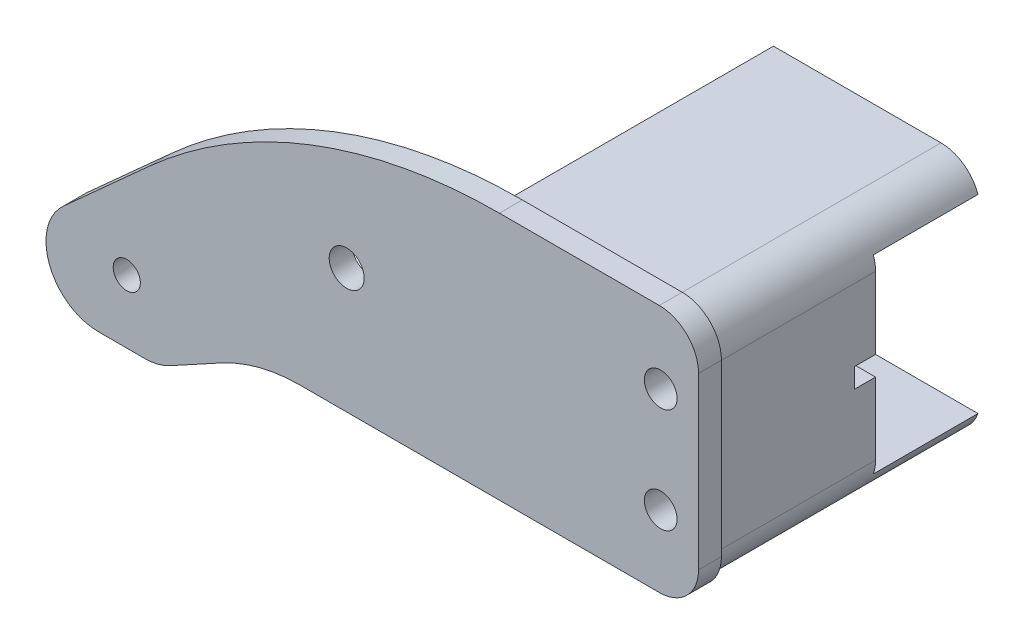
from build123d import *

# Parameters (mm, degrees)
SKETCH1_R                 = 2.075
SKETCH1_R_2               = 2.675
BOSS_EXTRUDE1_DEPTH       = 3.5
SKETCH2_4_W               = 8.840351234
SKETCH2_4_H               = 4
SKETCH2_4_H_2             = 13
SKETCH2_4_R               = 2.5
SKETCH2_4_W_2             = 33.159648766
BOSS_EXTRUDE3_DEPTH       = 24
SKETCH2_7_W               = 8.840351234
SKETCH2_7_H               = 3
BOSS_EXTRUDE5_DEPTH       = 20.8
SKETCH2_9_R               = 2.5
CUT_EXTRUDE3_DEPTH        = 81.663628326
BOSS_EXTRUDE6_START       = 24
BOSS_EXTRUDE6_OUTLINE_W   = 42
BOSS_EXTRUDE6_OUTLINE_H   = 4
BOSS_EXTRUDE6_OUTLINE_W_2 = 58.427054107
BOSS_EXTRUDE6_DEPTH       = 16
BOSS_EXTRUDE7_DEPTH       = 15.25
MEDZERA_SIZE              = 10.390521491
MEDZERA_SIZE_2            = 16
FILLET1_R                 = 8
BOSS_EXTRUDE8_START       = 7
SKETCH3_R                 = 5.280073369
SKETCH3_R_2               = 2.075
BOSS_EXTRUDE8_DEPTH       = 7
FILLET2_R                 = 11
FILLET3_R                 = 6
CHAMFER2_SIZE             = 2
FILLET4_R                 = 80
FILLET5_R                 = 25


# Read off the part's stored shape, not the designer's step: Boss-Extrude6
with BuildPart() as part:
    # Sketch1 → Boss-Extrude1 (new body)
    with BuildSketch(Plane.XY):
        Polygon((-56.932747655, 5.511620917), (-26.973961957, 5.511620917), (-11.681296445, 13.858299038), (55.612607206, 13.858299038), (55.612607206, 51.858299038), (-5.576823635, 51.858299038), align=None)
        with Locations((-31.780792342, 15.1829237)):
            Circle(SKETCH1_R, mode=Mode.SUBTRACT)
        with Locations((1.831518612, 32.908965344)):
            Circle(SKETCH1_R_2, mode=Mode.SUBTRACT)
    extrude(amount=BOSS_EXTRUDE1_DEPTH)

    # Sketch2<4> → Boss-Extrude3 (add)
    # profile 1 of 6: a face of its own
    with BuildSketch(Plane(origin=(0, 0, 0), x_dir=(-1, 0, 0), z_dir=(0, 0, -1))):
        Polygon((3.255184261, 18.408965344), (-13.171869846, 18.408965344), (-46.331518612, 18.408965344), (-46.331518612, 14.408965344), (3.255184261, 14.408965344), align=None)
    # profile 2 of 6: a face of its own
    with BuildSketch(Plane(origin=(0, 0, 0), x_dir=(-1, 0, 0), z_dir=(0, 0, -1))):
        with Locations((-50.751694229, 16.408965344)):
            Rectangle(SKETCH2_4_W, SKETCH2_4_H)
    # profile 3 of 6: a face of its own
    with BuildSketch(Plane(origin=(0, 0, 0), x_dir=(-1, 0, 0), z_dir=(0, 0, -1))):
        with Locations((-50.751694229, 24.908965344)):
            Rectangle(SKETCH2_4_W, SKETCH2_4_H_2)
        with Locations((-49.831518612, 24.908965344)):
            Circle(SKETCH2_4_R, mode=Mode.SUBTRACT)
    # profile 4 of 6: a face of its own
    with BuildSketch(Plane(origin=(0, 0, 0), x_dir=(-1, 0, 0), z_dir=(0, 0, -1))):
        with Locations((-50.751694229, 40.908965344)):
            Rectangle(SKETCH2_4_W, SKETCH2_4_H_2)
        with Locations((-49.831518612, 40.908965344)):
            Circle(SKETCH2_4_R, mode=Mode.SUBTRACT)
    # profile 5 of 6: a face of its own
    with BuildSketch(Plane(origin=(0, 0, 0), x_dir=(-1, 0, 0), z_dir=(0, 0, -1))):
        with Locations((-50.751694229, 49.408965344)):
            Rectangle(SKETCH2_4_W, SKETCH2_4_H)
    # profile 6 of 6: a face of its own
    with BuildSketch(Plane(origin=(0, 0, 0), x_dir=(-1, 0, 0), z_dir=(0, 0, -1))):
        with Locations((-29.751694229, 49.408965344)):
            Rectangle(SKETCH2_4_W_2, SKETCH2_4_H)
    extrude(amount=BOSS_EXTRUDE3_DEPTH)

    # Sketch2<7> → Boss-Extrude5 (add)
    with BuildSketch(Plane(origin=(0, 0, 0), x_dir=(-1, 0, 0), z_dir=(0, 0, -1))):
        with Locations((-50.751694229, 32.908965344)):
            Rectangle(SKETCH2_7_W, SKETCH2_7_H)
    extrude(amount=BOSS_EXTRUDE5_DEPTH)

    # Sketch2<9> → Cut-Extrude3 (cut, through all)
    with BuildSketch(Plane(origin=(0, 0, 0), x_dir=(-1, 0, 0), z_dir=(0, 0, -1))):
        with Locations((-49.831518612, 40.908965344)):
            Circle(SKETCH2_9_R)
        with Locations((-49.831518612, 24.908965344)):
            Circle(SKETCH2_9_R)
    extrude(amount=-CUT_EXTRUDE3_DEPTH, mode=Mode.SUBTRACT)

    # Boss-Extrude6 outline → Boss-Extrude6 (add)
    with BuildSketch(Plane(origin=(0, 0, 0), x_dir=(-1, 0, 0), z_dir=(0, 0, -1)).offset(BOSS_EXTRUDE6_START)):
        with Locations((-34.171869846, 49.408965344)):
            Rectangle(BOSS_EXTRUDE6_OUTLINE_W, BOSS_EXTRUDE6_OUTLINE_H)
        with Locations((-25.958342793, 16.408965344)):
            Rectangle(BOSS_EXTRUDE6_OUTLINE_W_2, BOSS_EXTRUDE6_OUTLINE_H)
    extrude(amount=BOSS_EXTRUDE6_DEPTH)

    # Sketch2 → Boss-Extrude7 (add)
    with BuildSketch(Plane(origin=(0, 0, 0), x_dir=(-1, 0, 0), z_dir=(0, 0, -1))):
        Polygon((-13.171869846, 47.408965344), (-46.331518612, 47.408965344), (-46.331518612, 34.408965344), (-46.331518612, 31.408965344), (-46.331518612, 18.408965344), (-13.171869846, 18.408965344), align=None)
    extrude(amount=BOSS_EXTRUDE7_DEPTH)

    # medzera
    # the kernel refuses this chamfer: 16, 10.390521491 mm, written as the material it takes off along each edge
    with BuildSketch(Plane(origin=(13.171869846, 51.408965344, 0), x_dir=(0.9987532912567346, 0.049918565722988195, 0), z_dir=(0, 0, -1))) as medzera_piece_1:
        Polygon((MEDZERA_SIZE * 0.998753291272, MEDZERA_SIZE * 0.0499185657238), (-MEDZERA_SIZE_2 * 0.049918565723, MEDZERA_SIZE_2 * 0.998753291257), (0, 0), align=None)
    extrude(amount=24, mode=Mode.SUBTRACT)
    with BuildSketch(Plane(origin=(13.171869846, 51.408965344, -24), x_dir=(0.9987532912576691, 0.04991856570429178, 0), z_dir=(0, 0, -1))) as medzera_piece_2:
        Polygon((MEDZERA_SIZE * 0.998753291272, MEDZERA_SIZE * 0.0499185657235), (-MEDZERA_SIZE_2 * 0.0499185657351, MEDZERA_SIZE_2 * 0.998753291256), (0, 0), align=None)
    extrude(amount=57.351056005, mode=Mode.SUBTRACT)

    # Fillet1
    fillet1_edges = [part.edges().sort_by_distance(p)[0] for p in [
        (-26.973961957, 5.511620917, 1.75),
        (-56.932747655, 5.511620917, 1.75),
    ]]
    fillet(fillet1_edges, radius=FILLET1_R)

    # Sketch3 → Boss-Extrude8 (add)
    with BuildSketch(Plane(origin=(0, 0, 0), x_dir=(-1, 0, 0), z_dir=(0, 0, -1)).offset(BOSS_EXTRUDE8_START)):
        with Locations((31.780792342, 15.1829237)):
            Circle(SKETCH3_R)
        with Locations((31.780792342, 15.1829237)):
            Circle(SKETCH3_R_2, mode=Mode.SUBTRACT)
    extrude(amount=-BOSS_EXTRUDE8_DEPTH)

    # Fillet2
    fillet2_edges = [part.edges().sort_by_distance(p)[0] for p in [
        (13.171869846, 18.408965344, -7.625),
    ]]
    fillet(fillet2_edges, radius=FILLET2_R)

    # Fillet3
    # the kernel refuses this fillet: 6 mm, written as the material it takes off along each edge
    with BuildSketch(Plane(origin=(55.612607206, 13.858299038, 0), x_dir=(0, 1, 0), z_dir=(0, 0, 1))) as fillet3_piece_1:
        with BuildLine():
            CenterArc((FILLET3_R, FILLET3_R), FILLET3_R, 180, 90)
            Line((0, FILLET3_R), (-FILLET3_R * 0.02, FILLET3_R))
            Line((-FILLET3_R * 0.02, FILLET3_R), (-FILLET3_R * 0.02, -FILLET3_R * 0.02))
            Line((-FILLET3_R * 0.02, -FILLET3_R * 0.02), (FILLET3_R, -FILLET3_R * 0.02))
            Line((FILLET3_R, -FILLET3_R * 0.02), (FILLET3_R, 0))
        make_face()
    extrude(amount=3.5, mode=Mode.SUBTRACT)
    with BuildSketch(Plane(origin=(55.171869846, 14.408965344, 0), x_dir=(0, 1, 0), z_dir=(0, 0, -1)), Plane(origin=(55.171869846, 51.408965344, 0), x_dir=(-1, 0, 0), z_dir=(0, 0, -1))) as fillet3_piece_2:
        with BuildLine():
            CenterArc((FILLET3_R, -FILLET3_R), FILLET3_R, 90, 90)
            Line((0, -FILLET3_R), (-FILLET3_R * 0.02, -FILLET3_R))
            Line((-FILLET3_R * 0.02, -FILLET3_R), (-FILLET3_R * 0.02, FILLET3_R * 0.02))
            Line((-FILLET3_R * 0.02, FILLET3_R * 0.02), (FILLET3_R, FILLET3_R * 0.02))
            Line((FILLET3_R, FILLET3_R * 0.02), (FILLET3_R, 0))
        make_face()
    extrude(amount=24, mode=Mode.SUBTRACT)
    with BuildSketch(Plane(origin=(55.612607206, 51.858299038, 0), x_dir=(0, -1, 0), z_dir=(0, 0, 1))) as fillet3_piece_3:
        with BuildLine():
            CenterArc((FILLET3_R, -FILLET3_R), FILLET3_R, 90, 90)
            Line((0, -FILLET3_R), (-FILLET3_R * 0.02, -FILLET3_R))
            Line((-FILLET3_R * 0.02, -FILLET3_R), (-FILLET3_R * 0.02, FILLET3_R * 0.02))
            Line((-FILLET3_R * 0.02, FILLET3_R * 0.02), (FILLET3_R, FILLET3_R * 0.02))
            Line((FILLET3_R, FILLET3_R * 0.02), (FILLET3_R, 0))
        make_face()
    extrude(amount=3.5, mode=Mode.SUBTRACT)
    with BuildSketch(Plane(origin=(55.171869846, 51.408965344, -24), x_dir=(-1.0, -3.189034221618264e-11, 0), z_dir=(0, 0, -1))) as fillet3_piece_4:
        with BuildLine():
            CenterArc((FILLET3_R, -FILLET3_R), FILLET3_R, 90.000000002, 90)
            Line((FILLET3_R * 1.14159348639e-10, -FILLET3_R), (-FILLET3_R * 0.0199999998858, -FILLET3_R))
            Line((-FILLET3_R * 0.0199999998858, -FILLET3_R), (-FILLET3_R * 0.0200000000006, FILLET3_R * 0.0199999999994))
            Line((-FILLET3_R * 0.0200000000006, FILLET3_R * 0.0199999999994), (FILLET3_R, FILLET3_R * 0.02))
            Line((FILLET3_R, FILLET3_R * 0.02), (FILLET3_R, 0))
        make_face()
    extrude(amount=16, mode=Mode.SUBTRACT)
    with BuildSketch(Plane(origin=(55.171869846, 14.408965344, -24), x_dir=(-8.227729608996468e-11, 1.0, 0), z_dir=(0, 0, -1))) as fillet3_piece_5:
        with BuildLine():
            CenterArc((FILLET3_R, -FILLET3_R), FILLET3_R, 90.000000005, 90)
            Line((FILLET3_R * 5.03884341753e-11, -FILLET3_R), (-FILLET3_R * 0.0199999999496, -FILLET3_R))
            Line((-FILLET3_R * 0.0199999999496, -FILLET3_R), (-FILLET3_R * 0.0200000000016, FILLET3_R * 0.0199999999984))
            Line((-FILLET3_R * 0.0200000000016, FILLET3_R * 0.0199999999984), (FILLET3_R, FILLET3_R * 0.02))
            Line((FILLET3_R, FILLET3_R * 0.02), (FILLET3_R, 0))
        make_face()
    extrude(amount=16, mode=Mode.SUBTRACT)

    # Chamfer2
    chamfer2_edges = [part.edges().sort_by_distance(p)[0] for p in [
        (-3.255184261, 18.408965344, -12),
    ]]
    chamfer(chamfer2_edges, length=CHAMFER2_SIZE)

    # Fillet4
    fillet4_edges = [part.edges().sort_by_distance(p)[0] for p in [
        (-5.576823635, 51.858299038, 1.75),
    ]]
    fillet(fillet4_edges, radius=FILLET4_R)

    # Fillet5
    fillet5_edges = [part.edges().sort_by_distance(p)[0] for p in [
        (-11.681296445, 13.858299038, 1.75),
    ]]
    fillet(fillet5_edges, radius=FILLET5_R)


solid = part.part
